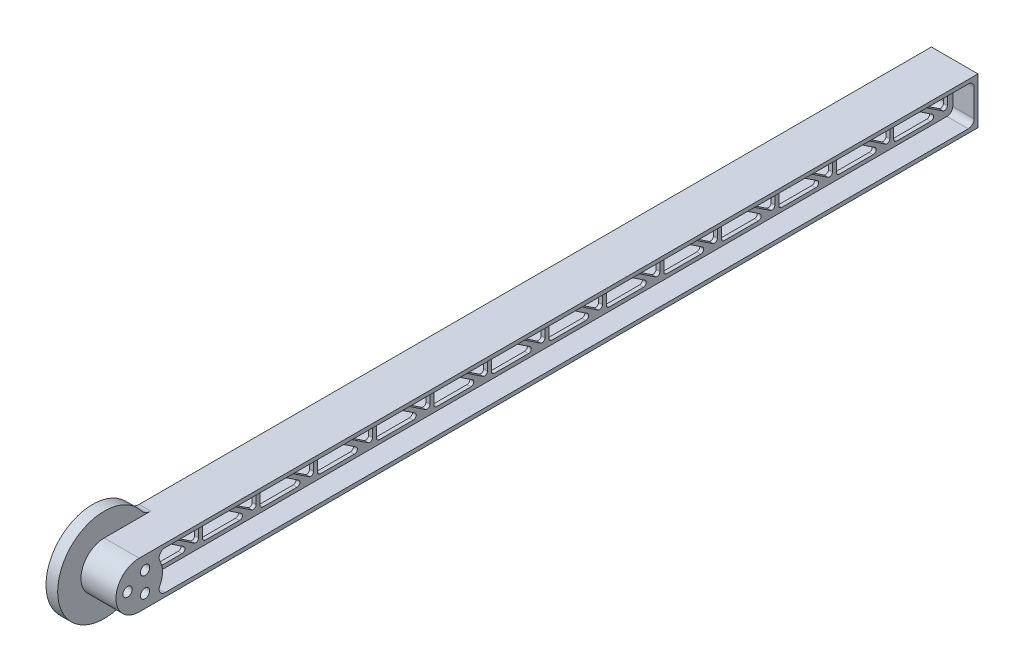
from build123d import *

# Parameters (mm, degrees)
SKETCH1_R           = 2.5527
BOSS_EXTRUDE1_DEPTH = 12.7
SKETCH3_R           = 25.4
BOSS_EXTRUDE2_DEPTH = 6.35
SKETCH4_R           = 2.5527
CUT_EXTRUDE1_DEPTH  = 459.301104624
FILLET1_R           = 6.35
CUT_EXTRUDE2_DEPTH  = 459.608940166
CUT_EXTRUDE3_DEPTH  = 11.6416582
CUT_EXTRUDE4_START  = -11.6416582
CUT_EXTRUDE4_DEPTH  = 11.6416582
FILLET2_R           = 3.175
FILLET3_R           = 1.5875


with BuildPart() as part:
    # Sketch1 → Boss-Extrude1 (new, symmetric)
    with BuildSketch(Plane(origin=(0, 0, 0), x_dir=(0, 0, -1), z_dir=(1, 0, 0))):
        with BuildLine():
            Line((0, 12.7), (457.2, 12.7))
            Line((457.2, 12.7), (457.2, -12.7))
            Line((457.2, -12.7), (0, -12.7))
            ThreePointArc((0, -12.7), (-12.7, 0), (0, 12.7))
        make_face()
        with Locations((3.175, 5.499261314)):
            Circle(SKETCH1_R, mode=Mode.SUBTRACT)
        with Locations((-6.35, 0)):
            Circle(SKETCH1_R, mode=Mode.SUBTRACT)
        with Locations((3.175, -5.499261314)):
            Circle(SKETCH1_R, mode=Mode.SUBTRACT)
    extrude(amount=BOSS_EXTRUDE1_DEPTH, both=True)

    # Sketch3 → Boss-Extrude2 (add)
    with BuildSketch(Plane.ZY.offset(12.7)):
        Circle(SKETCH3_R)
    extrude(amount=-BOSS_EXTRUDE2_DEPTH)

    # Sketch4 → Cut-Extrude1 (cut, through all)
    with BuildSketch(Plane(origin=(-6.35, 0, 0), x_dir=(0, 0, -1), z_dir=(1, 0, 0))):
        with Locations((3.175, 5.499261314)):
            Circle(SKETCH4_R)
        with Locations((3.175, -5.499261314)):
            Circle(SKETCH4_R)
        with Locations((-6.35, 0)):
            Circle(SKETCH4_R)
    extrude(amount=-CUT_EXTRUDE1_DEPTH, mode=Mode.SUBTRACT)

    # Fillet1
    fillet1_edges = [part.edges().sort_by_distance(p)[0] for p in [
        (-9.525, -12.7, -21.997045256),
        (-9.525, 12.7, -21.997045256),
    ]]
    fillet(fillet1_edges, radius=FILLET1_R)

    # Sketch5 → Cut-Extrude2 (cut, through all)
    with BuildSketch(Plane(origin=(12.7, 0, 0), x_dir=(0, 0, -1), z_dir=(1, 0, 0))):
        Polygon((420.799752233, -8.465985438), (420.799752233, 8.46582), (395.399752233, 8.46582), (405.457771561, 1.761107781), align=None)
        Polygon((422.915572233, -8.466026013), (448.315572229, -8.466513102), (422.915572233, 8.46582), align=None)
        Polygon((452.131450747, 8.46582), (426.731450747, 8.46582), (436.789592668, 1.760788133), (452.131450747, -8.466582), align=None)
        Polygon((14.816582, 8.46582), (14.816582, -8.4582), (40.216581995, -8.458687089), align=None)
        Polygon((18.633682215, 8.46582), (28.690226678, 1.764951571), (44.033682215, -8.458760289), (44.033682215, 8.46582), align=None)
        Polygon((46.150264215, 8.46582), (46.150264215, -8.458800878), (71.55026421, -8.459287968), align=None)
        Polygon((102.883852577, -8.459888844), (77.483852582, 8.46582), (77.483852582, -8.459401755), align=None)
        Polygon((49.967270582, 8.46582), (60.023937749, 1.764631904), (75.367270582, -8.459361165), (75.367270582, 8.46582), align=None)
        Polygon((134.217490015, -8.460489722), (108.81749002, 8.46582), (108.81749002, -8.460002632), align=None)
        Polygon((81.30090802, 8.46582), (91.357598917, 1.764378186), (106.70090802, -8.459962043), (106.70090802, 8.46582), align=None)
        Polygon((166.320731825, -8.461105357), (140.92073183, 8.46582), (140.92073183, -8.460618268), align=None)
        Polygon((113.40414983, 8.46582), (122.927959407, 2.119247139), (138.80414983, -8.460577679), (138.80414983, 8.46582), align=None)
        Polygon((197.654036391, -8.461706228), (172.254036396, 8.46582), (172.254036396, -8.461219139), align=None)
        Polygon((144.737454396, 8.46582), (154.794492636, 1.763665054), (170.137454396, -8.46117855), (170.137454396, 8.46582), align=None)
        Polygon((228.987247141, -8.462307098), (203.587247145, 8.46582), (203.587247145, -8.461820008), align=None)
        Polygon((176.070665145, 8.46582), (186.127826053, 1.76334539), (201.470665145, -8.461779419), (201.470665145, 8.46582), align=None)
        Polygon((260.319602083, -8.46290795), (234.919602087, 8.46582), (234.919602087, -8.462420861), align=None)
        Polygon((207.403782087, 8.46582), (217.461065654, 1.763025728), (232.803782087, -8.462380286), (232.803782087, 8.46582), align=None)
        Polygon((291.652625227, -8.463508816), (266.252625232, 8.46582), (266.252625232, -8.463021726), align=None)
        Polygon((238.736043232, 8.46582), (248.793449445, 1.762706075), (264.136043232, -8.462981137), (264.136043232, 8.46582), align=None)
        Polygon((322.985554579, -8.46410968), (297.585554584, 8.46582), (297.585554584, -8.46362259), align=None)
        Polygon((270.068972584, 8.46582), (280.126501439, 1.762386414), (295.468972584, -8.463582001), (295.468972584, 8.46582), align=None)
        Polygon((354.318390148, -8.464710542), (328.918390153, 8.46582), (328.918390153, -8.464223452), align=None)
        Polygon((301.401808153, 8.46582), (311.459459639, 1.762066754), (326.801808153, -8.464182863), (326.801808153, 8.46582), align=None)
        Polygon((385.65113194, -8.465311402), (360.251131945, 8.46582), (360.251131945, -8.464824312), align=None)
        Polygon((332.734549945, 8.46582), (342.792324054, 1.761747096), (358.134549945, -8.464783723), (358.134549945, 8.46582), align=None)
        Polygon((416.983779964, -8.46591226), (391.583779969, 8.46582), (391.583779969, -8.465425171), align=None)
        Polygon((364.067197969, 8.46582), (374.125094692, 1.761427438), (389.467197969, -8.465384582), (389.467197969, 8.46582), align=None)
    extrude(amount=-CUT_EXTRUDE2_DEPTH, mode=Mode.SUBTRACT)

    # Sketch5<5> → Cut-Extrude3 (cut)
    with BuildSketch(Plane(origin=(12.7, 0, 0), x_dir=(0, 0, -1), z_dir=(1, 0, 0))):
        with BuildLine():
            Line((455.0833418, -10.5833418), (455.0833418, 10.5833418))
            Line((455.0833418, 10.5833418), (7.020176376, 10.5833418))
            ThreePointArc((7.020176376, 10.5833418), (12.7, 0), (7.020176376, -10.5833418))
            Line((7.020176376, -10.5833418), (455.0833418, -10.5833418))
        make_face()
        Polygon((391.583779969, -8.465425171), (391.583779969, 8.46582), (416.983779964, -8.46591226), align=None, mode=Mode.SUBTRACT)
        Polygon((395.399752233, 8.46582), (420.799752233, 8.46582), (420.799752233, -8.465985438), (405.457771561, 1.761107781), align=None, mode=Mode.SUBTRACT)
        Polygon((422.915572233, 8.46582), (448.315572229, -8.466513102), (422.915572233, -8.466026013), align=None, mode=Mode.SUBTRACT)
        Polygon((436.789592668, 1.760788133), (426.731450747, 8.46582), (452.131450747, 8.46582), (452.131450747, -8.466582), align=None, mode=Mode.SUBTRACT)
        Polygon((14.816582, -8.4582), (14.816582, 8.46582), (40.216581995, -8.458687089), align=None, mode=Mode.SUBTRACT)
        Polygon((44.033682215, -8.458760289), (28.690226678, 1.764951571), (18.633682215, 8.46582), (44.033682215, 8.46582), align=None, mode=Mode.SUBTRACT)
        Polygon((71.55026421, -8.459287968), (46.150264215, -8.458800878), (46.150264215, 8.46582), align=None, mode=Mode.SUBTRACT)
        Polygon((75.367270582, -8.459361165), (60.023937749, 1.764631904), (49.967270582, 8.46582), (75.367270582, 8.46582), align=None, mode=Mode.SUBTRACT)
        Polygon((77.483852582, -8.459401755), (77.483852582, 8.46582), (102.883852577, -8.459888844), align=None, mode=Mode.SUBTRACT)
        Polygon((106.70090802, -8.459962043), (91.357598917, 1.764378186), (81.30090802, 8.46582), (106.70090802, 8.46582), align=None, mode=Mode.SUBTRACT)
        Polygon((108.81749002, -8.460002632), (108.81749002, 8.46582), (134.217490015, -8.460489722), align=None, mode=Mode.SUBTRACT)
        Polygon((138.80414983, -8.460577679), (122.927959407, 2.119247139), (113.40414983, 8.46582), (138.80414983, 8.46582), align=None, mode=Mode.SUBTRACT)
        Polygon((140.92073183, -8.460618268), (140.92073183, 8.46582), (166.320731825, -8.461105357), align=None, mode=Mode.SUBTRACT)
        Polygon((170.137454396, -8.46117855), (154.794492636, 1.763665054), (144.737454396, 8.46582), (170.137454396, 8.46582), align=None, mode=Mode.SUBTRACT)
        Polygon((172.254036396, -8.461219139), (172.254036396, 8.46582), (197.654036391, -8.461706228), align=None, mode=Mode.SUBTRACT)
        Polygon((201.470665145, -8.461779419), (186.127826053, 1.76334539), (176.070665145, 8.46582), (201.470665145, 8.46582), align=None, mode=Mode.SUBTRACT)
        Polygon((203.587247145, -8.461820008), (203.587247145, 8.46582), (228.987247141, -8.462307098), align=None, mode=Mode.SUBTRACT)
        Polygon((232.803782087, -8.462380286), (217.461065654, 1.763025728), (207.403782087, 8.46582), (232.803782087, 8.46582), align=None, mode=Mode.SUBTRACT)
        Polygon((234.919602087, -8.462420861), (234.919602087, 8.46582), (260.319602083, -8.46290795), align=None, mode=Mode.SUBTRACT)
        Polygon((264.136043232, -8.462981137), (248.793449445, 1.762706075), (238.736043232, 8.46582), (264.136043232, 8.46582), align=None, mode=Mode.SUBTRACT)
        Polygon((266.252625232, -8.463021726), (266.252625232, 8.46582), (291.652625227, -8.463508816), align=None, mode=Mode.SUBTRACT)
        Polygon((295.468972584, -8.463582001), (280.126501439, 1.762386414), (270.068972584, 8.46582), (295.468972584, 8.46582), align=None, mode=Mode.SUBTRACT)
        Polygon((297.585554584, -8.46362259), (297.585554584, 8.46582), (322.985554579, -8.46410968), align=None, mode=Mode.SUBTRACT)
        Polygon((326.801808153, -8.464182863), (311.459459639, 1.762066754), (301.401808153, 8.46582), (326.801808153, 8.46582), align=None, mode=Mode.SUBTRACT)
        Polygon((328.918390153, -8.464223452), (328.918390153, 8.46582), (354.318390148, -8.464710542), align=None, mode=Mode.SUBTRACT)
        Polygon((358.134549945, -8.464783723), (342.792324054, 1.761747096), (332.734549945, 8.46582), (358.134549945, 8.46582), align=None, mode=Mode.SUBTRACT)
        Polygon((360.251131945, -8.464824312), (360.251131945, 8.46582), (385.65113194, -8.465311402), align=None, mode=Mode.SUBTRACT)
        Polygon((389.467197969, -8.465384582), (374.125094692, 1.761427438), (364.067197969, 8.46582), (389.467197969, 8.46582), align=None, mode=Mode.SUBTRACT)
    extrude(amount=-CUT_EXTRUDE3_DEPTH, mode=Mode.SUBTRACT)

    # Sketch7 → Cut-Extrude4 (cut)
    with BuildSketch(Plane.ZY.offset(12.7).offset(CUT_EXTRUDE4_START)):
        with BuildLine():
            ThreePointArc((-7.020061498, -10.583418), (-12.7, 0), (-7.020061498, 10.583418))
            Line((-7.020061498, 10.583418), (-455.083418, 10.583418))
            Line((-455.083418, 10.583418), (-455.083418, -10.583418))
            Line((-455.083418, -10.583418), (-7.020061498, -10.583418))
        make_face()
    extrude(amount=CUT_EXTRUDE4_DEPTH, mode=Mode.SUBTRACT)

    # Fillet2
    fillet2_edges = [part.edges().sort_by_distance(p)[0] for p in [
        (-6.8791709, -10.583418, -455.083418),
        (6.8791709, -10.5833418, -455.0833418),
        (-6.8791709, 10.583418, -455.083418),
        (6.8791709, 10.5833418, -455.0833418),
        (-6.8791709, -10.583418, -7.020061498),
        (6.8791709, -10.5833418, -7.020176376),
        (-6.8791709, 10.583418, -7.020061498),
        (6.8791709, 10.5833418, -7.020176376),
    ]]
    fillet(fillet2_edges, radius=FILLET2_R)

    # Fillet3
    fillet3_edges = [part.edges().sort_by_distance(p)[0] for p in [
        (0, -8.458800878, -46.150264215),
        (0, 8.46582, -46.150264215),
        (0, -8.459287968, -71.55026421),
        (0, -8.459361165, -75.367270582),
        (0, 8.46582, -49.967270582),
        (0, 8.46582, -75.367270582),
        (0, 8.46582, -77.483852582),
        (0, -8.459888844, -102.883852577),
        (0, -8.459401755, -77.483852582),
        (0, -8.459962043, -106.70090802),
        (0, 8.46582, -81.30090802),
        (0, 8.46582, -106.70090802),
        (0, 8.46582, -108.81749002),
        (0, -8.460489722, -134.217490015),
        (0, -8.460002632, -108.81749002),
        (0, -8.460577679, -138.80414983),
        (0, 8.46582, -113.40414983),
        (0, 8.46582, -138.80414983),
        (0, -8.461219139, -172.254036396),
        (0, 8.46582, -172.254036396),
        (0, -8.461706228, -197.654036391),
        (0, -8.461779419, -201.470665145),
        (0, 8.46582, -176.070665145),
        (0, 8.46582, -201.470665145),
        (0, 8.46582, -203.587247145),
        (0, -8.462307098, -228.987247141),
        (0, -8.461820008, -203.587247145),
        (0, -8.462380286, -232.803782087),
        (0, 8.46582, -207.403782087),
        (0, 8.46582, -232.803782087),
        (0, 8.46582, -234.919602087),
        (0, -8.46290795, -260.319602083),
        (0, -8.462420861, -234.919602087),
        (0, -8.462981137, -264.136043232),
        (0, 8.46582, -238.736043232),
        (0, 8.46582, -264.136043232),
        (0, -8.464824312, -360.251131945),
        (0, 8.46582, -360.251131945),
        (0, -8.465311402, -385.65113194),
        (0, -8.465384582, -389.467197969),
        (0, 8.46582, -364.067197969),
        (0, 8.46582, -389.467197969),
        (0, 8.46582, -391.583779969),
        (0, -8.46591226, -416.983779964),
        (0, -8.465425171, -391.583779969),
        (0, -8.465985438, -420.799752233),
        (0, 8.46582, -395.399752233),
        (0, 8.46582, -420.799752233),
        (0, 8.46582, -422.915572233),
        (0, -8.466513102, -448.315572229),
        (0, -8.466026013, -422.915572233),
        (0, -8.466582, -452.131450747),
        (0, 8.46582, -426.731450747),
        (0, 8.46582, -452.131450747),
        (0, -8.464783723, -358.134549945),
        (0, 8.46582, -332.734549945),
        (0, 8.46582, -358.134549945),
        (0, 8.46582, -328.918390153),
        (0, -8.464710542, -354.318390148),
        (0, -8.464223452, -328.918390153),
        (0, -8.464182863, -326.801808153),
        (0, 8.46582, -301.401808153),
        (0, 8.46582, -326.801808153),
        (0, 8.46582, -297.585554584),
        (0, -8.46410968, -322.985554579),
        (0, -8.46362259, -297.585554584),
        (0, -8.463582001, -295.468972584),
        (0, 8.46582, -270.068972584),
        (0, 8.46582, -295.468972584),
        (0, -8.463021726, -266.252625232),
        (0, 8.46582, -266.252625232),
        (0, -8.463508816, -291.652625227),
        (0, -8.46117855, -170.137454396),
        (0, 8.46582, -144.737454396),
        (0, 8.46582, -170.137454396),
        (0, -8.460618268, -140.92073183),
        (0, 8.46582, -140.92073183),
        (0, -8.461105357, -166.320731825),
        (0, -8.458760289, -44.033682215),
        (0, 8.46582, -18.633682215),
        (0, 8.46582, -44.033682215),
        (0, 8.46582, -14.816582),
        (0, -8.458687089, -40.216581995),
        (0, -8.4582, -14.816582),
    ]]
    fillet(fillet3_edges, radius=FILLET3_R)


solid = part.part
